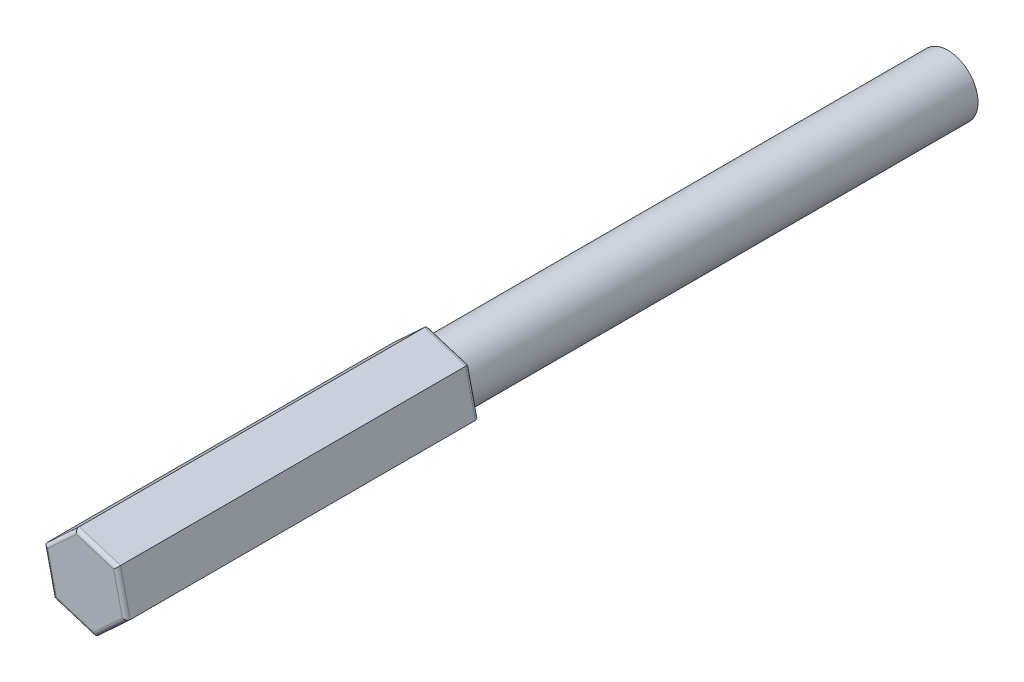
from build123d import *

# Parameters (mm, degrees)
BOSS_EXTRUDE1_DEPTH      = 85
BOSS_EXTRUDE1_DEPTH_BACK = 30
SKETCH1_R                = 4
BOSS_EXTRUDE2_DEPTH      = 47
FILLET1_R                = 0.5


with BuildPart() as part:
    # Sketch1 → Boss-Extrude1 (new, two sides: drawn at the far end of the back side and taken through both)
    with BuildSketch(Plane.XY.offset(-BOSS_EXTRUDE1_DEPTH_BACK)):
        Circle(SKETCH1_R)
    extrude(amount=BOSS_EXTRUDE1_DEPTH + BOSS_EXTRUDE1_DEPTH_BACK)

    # Sketch2 → Boss-Extrude2 (add)
    with BuildSketch(Plane.XY.offset(85)):
        Polygon((5.513335358, -1.713612138), (4.240699323, 3.917882411), (-1.272636036, 5.631494549), (-5.513335358, 1.713612138), (-4.240699323, -3.917882411), (1.272636036, -5.631494549), align=None)
    extrude(amount=-BOSS_EXTRUDE2_DEPTH)

    # Fillet1
    fillet1_edges = [part.edges().sort_by_distance(p)[0] for p in [
        (1.484031644, 4.77468848, 38),
        (4.877017341, 1.102135137, 38),
        (3.392985697, -3.672553343, 85),
        (4.877017341, 1.102135137, 85),
        (1.484031644, 4.77468848, 85),
        (-3.392985697, 3.672553343, 85),
        (-4.877017341, -1.102135137, 85),
        (-1.484031644, -4.77468848, 85),
        (-4, 0, 38),
        (3.392985697, -3.672553343, 38),
        (-1.484031644, -4.77468848, 38),
        (-4.877017341, -1.102135137, 38),
        (-3.392985697, 3.672553343, 38),
    ]]
    fillet(fillet1_edges, radius=FILLET1_R - 0.0001)  # a hair under: the kernel refuses the full size


solid = part.part
